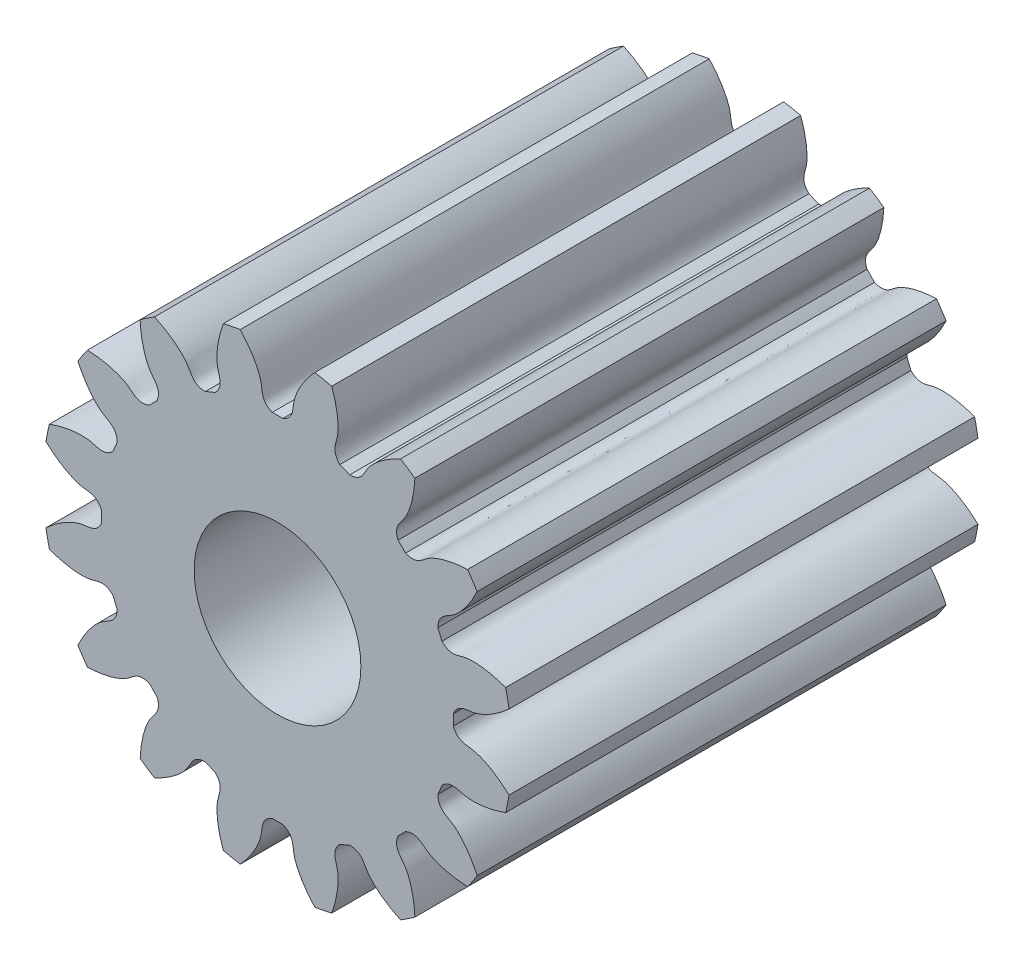
from build123d import *

# Parameters (mm, degrees)
SKETCH_1_R               = 4.5
EXTRUDE_1_DEPTH          = 9
CUT_EXTRUDE_1_DEPTH      = 12.022703843
PATTERN_CIRCULAR_1_COUNT = 16
SKETCH_4_R               = 1.6
CUT_EXTRUDE_2_DEPTH      = 10


with BuildPart() as part:
    # 草图1 → 凸台-拉伸1 (new body)
    with BuildSketch(Plane.XY):
        Circle(SKETCH_1_R)
    extrude(amount=EXTRUDE_1_DEPTH)

    # 草图2 → 切除-拉伸1 (cut, through all)
    with BuildSketch(Plane.XY):
        with BuildLine():
            ThreePointArc((0.101680395, 3.373467963), (0, 3.375), (-0.101680395, 3.373467963))
            add(Edge.make_bspline(
                [(-0.101680395, 3.373467963), (-0.320919735, 3.465061005), (-0.284660598, 3.635349809), (-0.322390644, 3.793404963), (-0.325601394, 3.80577545), (-0.329466049, 3.819526781), (-0.334039479, 3.834637453), (-0.339377888, 3.851083952), (-0.345536205, 3.868841182), (-0.352568839, 3.887882349), (-0.360529384, 3.908179024), (-0.369470654, 3.92970115), (-0.379444617, 3.952417062), (-0.390502356, 3.976293514), (-0.402694025, 4.001295699), (-0.416068812, 4.02738727), (-0.430674889, 4.054530373), (-0.446559381, 4.082685666), (-0.463768319, 4.111812348), (-0.482346604, 4.141868189), (-0.502337967, 4.172809557), (-0.523784931, 4.20459145), (-0.546728776, 4.237167525), (-0.571209498, 4.270490132), (-0.597265778, 4.304510345), (-0.624934946, 4.339177997), (-0.654252942, 4.374441713), (-0.685254293, 4.41024895), (-0.717972069, 4.446546028), (-0.752437861, 4.483278171), (-0.788681746, 4.520389541), (-0.826732258, 4.557823283), (-0.866616358, 4.595521557), (-0.90835941, 4.633425586), (-0.951985152, 4.67147569), (-0.99751567, 4.709611333), (-1.044971373, 4.747771162), (-1.094370973, 4.785893051), (-1.145731456, 4.823914147), (-1.199068069, 4.861770908), (-1.254394289, 4.899399156), (-1.311721817, 4.936734114), (-1.371060539, 4.97371046), (-1.453732402, 5.022959339), (-1.517494148, 5.058370721), (-1.560889991, 5.081371225)],
                knots=[0, 0, 0, 0, 0.200958108, 0.205848205, 0.211390316, 0.217584439, 0.224430575, 0.231928724, 0.240078886, 0.248881062, 0.25833525, 0.268441451, 0.279199665, 0.290609892, 0.302672132, 0.315386384, 0.32875265, 0.342770929, 0.357441221, 0.372763526, 0.388737843, 0.405364174, 0.422642518, 0.440572874, 0.459155244, 0.478389626, 0.498276022, 0.51881443, 0.540004852, 0.561847286, 0.584341734, 0.607488194, 0.631286667, 0.655737153, 0.680839653, 0.706594165, 0.73300069, 0.760059228, 0.787769779, 0.816132343, 0.84514692, 0.87481351, 0.905132113, 0.936102729, 1, 1, 1, 1], degree=3))
            ThreePointArc((-1.560889991, 5.081371225), (0, 5.315704195), (1.560889991, 5.081371225))
            add(Edge.make_bspline(
                [(0.101680395, 3.373467963), (0.320919735, 3.465061005), (0.284660598, 3.635349809), (0.322390644, 3.793404963), (0.325601394, 3.80577545), (0.329466049, 3.819526781), (0.334039479, 3.834637453), (0.339377888, 3.851083952), (0.345536205, 3.868841182), (0.352568839, 3.887882349), (0.360529384, 3.908179024), (0.369470654, 3.92970115), (0.379444617, 3.952417062), (0.390502356, 3.976293514), (0.402694025, 4.001295699), (0.416068812, 4.02738727), (0.430674889, 4.054530373), (0.446559381, 4.082685666), (0.463768319, 4.111812348), (0.482346604, 4.141868189), (0.502337967, 4.172809557), (0.523784931, 4.20459145), (0.546728776, 4.237167525), (0.571209498, 4.270490132), (0.597265778, 4.304510345), (0.624934946, 4.339177997), (0.654252942, 4.374441713), (0.685254293, 4.41024895), (0.717972069, 4.446546028), (0.752437861, 4.483278171), (0.788681746, 4.520389541), (0.826732258, 4.557823283), (0.866616358, 4.595521557), (0.90835941, 4.633425586), (0.951985152, 4.67147569), (0.99751567, 4.709611333), (1.044971373, 4.747771162), (1.094370973, 4.785893051), (1.145731456, 4.823914147), (1.199068069, 4.861770908), (1.254394289, 4.899399156), (1.311721817, 4.936734114), (1.371060539, 4.97371046), (1.453732402, 5.022959339), (1.517494148, 5.058370721), (1.560889991, 5.081371225)],
                knots=[0, 0, 0, 0, 0.200958108, 0.205848205, 0.211390316, 0.217584439, 0.224430575, 0.231928724, 0.240078886, 0.248881062, 0.25833525, 0.268441451, 0.279199665, 0.290609892, 0.302672132, 0.315386384, 0.32875265, 0.342770929, 0.357441221, 0.372763526, 0.388737843, 0.405364174, 0.422642518, 0.440572874, 0.459155244, 0.478389626, 0.498276022, 0.51881443, 0.540004852, 0.561847286, 0.584341734, 0.607488194, 0.631286667, 0.655737153, 0.680839653, 0.706594165, 0.73300069, 0.760059228, 0.787769779, 0.816132343, 0.84514692, 0.87481351, 0.905132113, 0.936102729, 1, 1, 1, 1], degree=3))
        make_face()
    cut_extrude_1 = extrude(amount=CUT_EXTRUDE_1_DEPTH, mode=Mode.SUBTRACT)

    # 阵列(圆周)1: 切除-拉伸1 ×16 about axis
    pattern_circular_1_axis = Axis((0, 0, 9), (0, 0, -1))
    for i in range(1, PATTERN_CIRCULAR_1_COUNT):
        add(cut_extrude_1.rotate(pattern_circular_1_axis, i * 360 / PATTERN_CIRCULAR_1_COUNT), mode=Mode.SUBTRACT)

    # 草图4 → 切除-拉伸2 (cut)
    with BuildSketch(Plane.XY.offset(9)):
        Circle(SKETCH_4_R)
    extrude(amount=-CUT_EXTRUDE_2_DEPTH, mode=Mode.SUBTRACT)


solid = part.part
